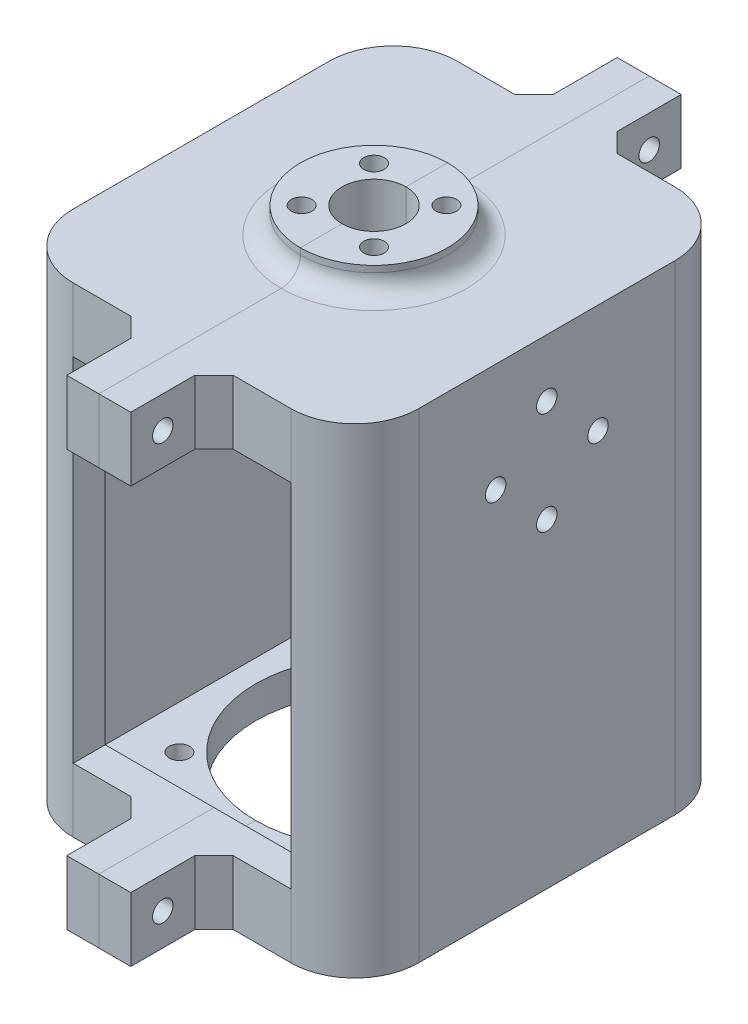
from build123d import *

# Parameters (mm, degrees)
SKETCH2_W                                  = 54
SKETCH2_H                                  = 60
BOSS_EXTRUDE1_DEPTH                        = 75
SHELL2_T                                   = -5
SKETCH4_R                                  = 18.5
CUT_EXTRUDE2_DEPTH                         = 86.170417399
SKETCH5_R                                  = 1.6
CUT_EXTRUDE3_DEPTH                         = 86.170417399
CIRPATTERN2_COUNT                          = 4
SKETCH6_R                                  = 1.6
CUT_EXTRUDE4_DEPTH                         = 98.164808444
CIRPATTERN3_COUNT                          = 4
SKETCH7_W                                  = 44
SKETCH7_H                                  = 50
BOSS_EXTRUDE2_DEPTH                        = 5
SKETCH8_R                                  = 5
CUT_EXTRUDE5_DEPTH                         = 86.170417399
SKETCH9_R                                  = 1.6
CUT_EXTRUDE6_DEPTH                         = 86.170417399
CIRPATTERN4_COUNT                          = 4
SKETCH10_W                                 = 34
SKETCH10_H                                 = 55
CUT_EXTRUDE7_DEPTH                         = 100.76973489
FILLET1_R                                  = 10
SKETCH11_W                                 = 13
SKETCH11_H                                 = 10
SKETCH11_R                                 = 1.6
BOSS_EXTRUDE3_DEPTH                        = 5
MIRROR4_AT_THE_SECOND_PLANE_COPY_1_SKETC_W = 13
MIRROR4_AT_THE_SECOND_PLANE_COPY_1_SKETC_H = 10
MIRROR4_AT_THE_SECOND_PLANE_COPY_1_SKETC_R = 1.6
MIRROR4_AT_THE_SECOND_PLANE_COPY_1_DEPTH   = 5
CHAMFER1_SIZE                              = 3
BOSS_EXTRUDE4_START                        = 4
SKETCH12_R                                 = 11.5
SKETCH12_R_2                               = 1.6
SKETCH12_R_3                               = 5
BOSS_EXTRUDE4_DEPTH                        = 4
FILLET2_R                                  = 3


with BuildPart() as part:
    # Sketch2 → Boss-Extrude1 (new body)
    with BuildSketch(Plane(origin=(0, 0, 0), x_dir=(1, 0, 0), z_dir=(0, 1, 0))):
        Rectangle(SKETCH2_W, SKETCH2_H)
    extrude(amount=BOSS_EXTRUDE1_DEPTH)

    # Shell2
    shell2_openings = [part.faces().sort_by_distance(p)[0] for p in [
        (0, 75, 0),
    ]]
    offset(amount=SHELL2_T, openings=shell2_openings, kind=Kind.INTERSECTION)

    # Sketch4 → Cut-Extrude2 (cut, through all)
    with BuildSketch(Plane.XZ):
        with Locations(Location((0, 0, 0), (0, 0, 270))):
            Circle(SKETCH4_R)
    extrude(amount=-CUT_EXTRUDE2_DEPTH, mode=Mode.SUBTRACT)

    # Sketch5 → Cut-Extrude3 (cut, through all)
    with BuildSketch(Plane.XZ):
        with Locations(Location((15.202795796, 15.202795796, 0), (0, 0, 270))):
            Circle(SKETCH5_R)
    cut_extrude3 = extrude(amount=-CUT_EXTRUDE3_DEPTH, mode=Mode.SUBTRACT)

    # CirPattern2: Cut-Extrude3 ×4 about axis
    cirpattern2_axis = Axis((0, 0, 0), (0, 1, 0))
    for i in range(1, CIRPATTERN2_COUNT):
        add(cut_extrude3.rotate(cirpattern2_axis, i * 360 / CIRPATTERN2_COUNT), mode=Mode.SUBTRACT)

    # Sketch6 → Cut-Extrude4 (cut, through all)
    with BuildSketch(Plane(origin=(27, 0, 0), x_dir=(0, 0, -1), z_dir=(1, 0, 0))):
        with Locations((0, 66)):
            Circle(SKETCH6_R)
    cut_extrude4 = extrude(amount=-CUT_EXTRUDE4_DEPTH, mode=Mode.SUBTRACT)

    # CirPattern3: Cut-Extrude4 ×4 about axis
    cirpattern3_axis = Axis((0, 58, 0), (1, 0, 0))
    for i in range(1, CIRPATTERN3_COUNT):
        add(cut_extrude4.rotate(cirpattern3_axis, i * 360 / CIRPATTERN3_COUNT), mode=Mode.SUBTRACT)

    # Sketch7 → Boss-Extrude2 (add)
    with BuildSketch(Plane(origin=(0, 75, 0), x_dir=(1, 0, 0), z_dir=(0, 1, 0))):
        Rectangle(SKETCH7_W, SKETCH7_H)
    extrude(amount=-BOSS_EXTRUDE2_DEPTH)

    # Sketch8 → Cut-Extrude5 (cut, through all)
    with BuildSketch(Plane(origin=(0, 75, 0), x_dir=(1, 0, 0), z_dir=(0, 1, 0))):
        with Locations(Location((0, 0, 0), (0, 0, 270))):
            Circle(SKETCH8_R)
    extrude(amount=-CUT_EXTRUDE5_DEPTH, mode=Mode.SUBTRACT)

    # Sketch9 → Cut-Extrude6 (cut, through all)
    with BuildSketch(Plane(origin=(0, 75, 0), x_dir=(1, 0, 0), z_dir=(0, 1, 0))):
        with Locations(Location((5.656854249, 5.656854249, 0), (0, 0, 270))):
            Circle(SKETCH9_R)
    cut_extrude6 = extrude(amount=-CUT_EXTRUDE6_DEPTH, mode=Mode.SUBTRACT)

    # CirPattern4: Cut-Extrude6 ×4 about axis
    cirpattern4_axis = Axis((0, 0, 0), (0, 1, 0))
    for i in range(1, CIRPATTERN4_COUNT):
        add(cut_extrude6.rotate(cirpattern4_axis, i * 360 / CIRPATTERN4_COUNT), mode=Mode.SUBTRACT)

    # Sketch10 → Cut-Extrude7 (cut, through all)
    with BuildSketch(Plane(origin=(0, 0, -30), x_dir=(-1, 0, 0), z_dir=(0, 0, -1))):
        with Locations((0, 37.5)):
            Rectangle(SKETCH10_W, SKETCH10_H)
    extrude(amount=-CUT_EXTRUDE7_DEPTH, mode=Mode.SUBTRACT)

    # Fillet1
    fillet1_edges = [part.edges().sort_by_distance(p)[0] for p in [
        (27, 37.5, 30),
        (-27, 37.5, 30),
        (-27, 37.5, -30),
        (27, 37.5, -30),
    ]]
    fillet(fillet1_edges, radius=FILLET1_R - 0.0001)  # a hair under: the kernel refuses the full size

    # Sketch11 → Boss-Extrude3 (add, symmetric)
    with BuildSketch(Plane(origin=(0, 0, 0), x_dir=(0, 0, -1), z_dir=(1, 0, 0))):
        with Locations((36.5, 70)):
            Rectangle(SKETCH11_W, SKETCH11_H)
        with Locations((38, 70)):
            Circle(SKETCH11_R, mode=Mode.SUBTRACT)
    boss_extrude3 = extrude(amount=BOSS_EXTRUDE3_DEPTH, both=True)

    # Mirror4: Boss-Extrude3 across plane
    add(boss_extrude3.mirror(Plane.XY))

    # Mirror4 at the second plane: Boss-Extrude3 across plane
    add(boss_extrude3.mirror(Plane.ZX.offset(37.5)))

    # Mirror4 at the second plane copy 1 sketc → Mirror4 at the second plane copy 1 (add, symmetric)
    with BuildSketch(Plane(origin=(0, 75, 0), x_dir=(0, 0, 1), z_dir=(1, 0, 0))):
        with Locations((36.5, 70)):
            Rectangle(MIRROR4_AT_THE_SECOND_PLANE_COPY_1_SKETC_W, MIRROR4_AT_THE_SECOND_PLANE_COPY_1_SKETC_H)
        with Locations((38, 70)):
            Circle(MIRROR4_AT_THE_SECOND_PLANE_COPY_1_SKETC_R, mode=Mode.SUBTRACT)
    extrude(amount=MIRROR4_AT_THE_SECOND_PLANE_COPY_1_DEPTH, both=True)

    # Chamfer1
    chamfer1_edges = [part.edges().sort_by_distance(p)[0] for p in [
        (-5, 70, -30),
        (5, 70, -30),
        (5, 5, -30),
        (-5, 5, -30),
        (5, 70, 30),
        (-5, 70, 30),
        (-5, 5, 30),
        (5, 5, 30),
    ]]
    chamfer(chamfer1_edges, length=CHAMFER1_SIZE)

    # Sketch12 → Boss-Extrude4 (add)
    with BuildSketch(Plane(origin=(0, 75, 0), x_dir=(1, 0, 0), z_dir=(0, 1, 0)).offset(BOSS_EXTRUDE4_START)):
        with Locations(Location((0, 0, 0), (0, 0, 270))):
            Circle(SKETCH12_R)
        with Locations(Location((5.656854249, -5.656854249, 0), (0, 0, 270))):
            Circle(SKETCH12_R_2, mode=Mode.SUBTRACT)
        with Locations(Location((-5.656854249, -5.656854249, 0), (0, 0, 270))):
            Circle(SKETCH12_R_2, mode=Mode.SUBTRACT)
        with Locations(Location((-5.656854249, 5.656854249, 0), (0, 0, 270))):
            Circle(SKETCH12_R_2, mode=Mode.SUBTRACT)
        with Locations(Location((5.656854249, 5.656854249, 0), (0, 0, 270))):
            Circle(SKETCH12_R_2, mode=Mode.SUBTRACT)
        with Locations(Location((0, 0, 0), (0, 0, 270))):
            Circle(SKETCH12_R_3, mode=Mode.SUBTRACT)
    extrude(amount=-BOSS_EXTRUDE4_DEPTH)

    # Fillet2
    fillet2_edges = [part.edges().sort_by_distance(p)[0] for p in [
        (0, 75, -11.5),
    ]]
    fillet(fillet2_edges, radius=FILLET2_R)


with BuildPart() as body_2:
    # Split1: the piece on the far side of the plane
    add(part.part)
    split(bisect_by=Plane(origin=(0, 0, 0), x_dir=(0, 0, 1), z_dir=(1, 0, 0)), keep=Keep.BOTTOM)


with BuildPart() as part_1:
    add(part.part)

    # Split1
    split(bisect_by=Plane(origin=(0, 0, 0), x_dir=(0, 0, 1), z_dir=(1, 0, 0)), keep=Keep.TOP)


solid = Compound([body_2.part, part_1.part])
